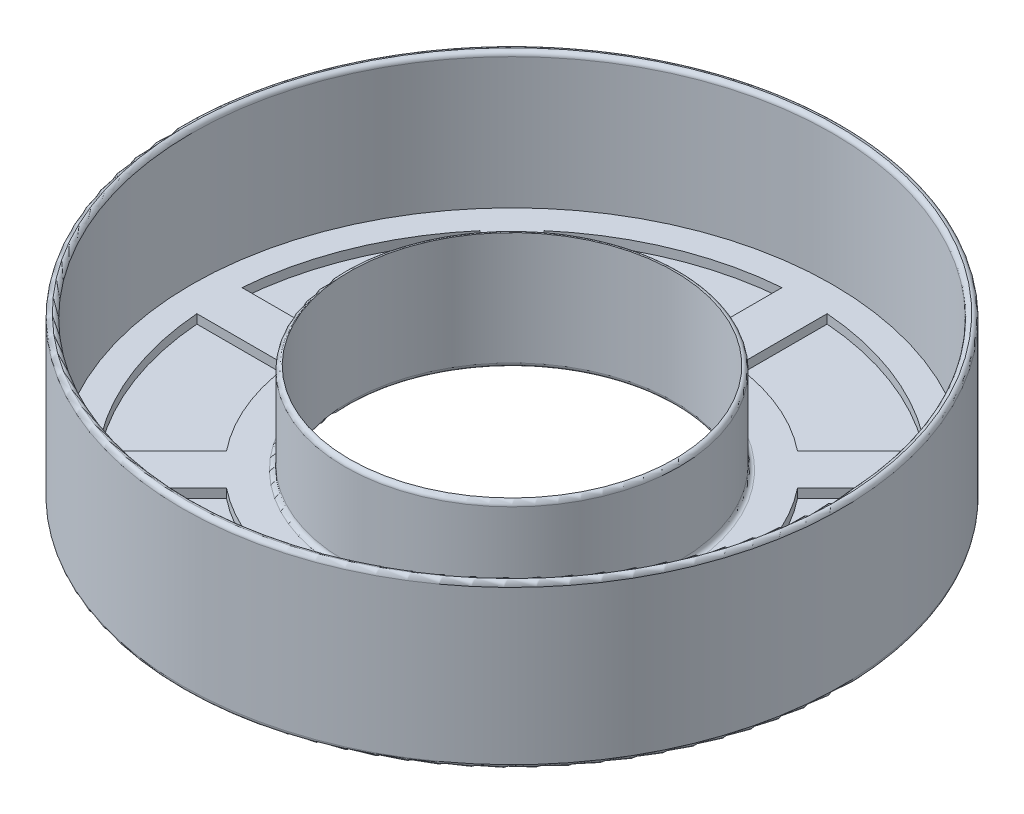
from build123d import *

# Parameters (mm, degrees)
SKETCH2_R           = 36.5
SKETCH2_R_2         = 18
BOSS_EXTRUDE1_DEPTH = 3
SKETCH3_R           = 36.5
SKETCH3_R_2         = 35.5
BOSS_EXTRUDE2_DEPTH = 15
SKETCH4_R           = 18.5
SKETCH4_R_2         = 18
BOSS_EXTRUDE3_DEPTH = 10
FILLET1_R           = 0.5
CUT_EXTRUDE1_DEPTH  = 1


with BuildPart() as part:
    # Sketch2 → Boss-Extrude1 (new body)
    with BuildSketch(Plane(origin=(0, 0, 0), x_dir=(1, 0, 0), z_dir=(0, 1, 0))):
        with Locations(Location((0, 0, 0), (0, 0, 270))):
            Circle(SKETCH2_R)
        with Locations(Location((0, 0, 0), (0, 0, 270))):
            Circle(SKETCH2_R_2, mode=Mode.SUBTRACT)
    extrude(amount=BOSS_EXTRUDE1_DEPTH)

    # Sketch3 → Boss-Extrude2 (add)
    with BuildSketch(Plane(origin=(0, 3, 0), x_dir=(1, 0, 0), z_dir=(0, 1, 0))):
        with Locations(Location((0, 0, 0), (0, 0, 270))):
            Circle(SKETCH3_R)
        with Locations(Location((0, 0, 0), (0, 0, 270))):
            Circle(SKETCH3_R_2, mode=Mode.SUBTRACT)
    extrude(amount=BOSS_EXTRUDE2_DEPTH)

    # Sketch4 → Boss-Extrude3 (add)
    with BuildSketch(Plane(origin=(0, 3, 0), x_dir=(1, 0, 0), z_dir=(0, 1, 0))):
        with Locations(Location((0, 0, 0), (0, 0, 270))):
            Circle(SKETCH4_R)
        with Locations(Location((0, 0, 0), (0, 0, 270))):
            Circle(SKETCH4_R_2, mode=Mode.SUBTRACT)
    extrude(amount=BOSS_EXTRUDE3_DEPTH)

    # Fillet1
    fillet1_edges = [part.edges().sort_by_distance(p)[0] for p in [
        (0, 18, -35.5),
        (0, 18, -36.5),
        (0, 3, -18.5),
        (0, 13, -18.5),
        (0, 0, -36.5),
        (0, 0, -18),
    ]]
    fillet(fillet1_edges, radius=FILLET1_R - 0.0001)  # a hair under: the kernel refuses the full size

    # Sketch5 → Cut-Extrude1 (cut)
    with BuildSketch(Plane(origin=(0, 3, 0), x_dir=(1, 0, 0), z_dir=(0, 1, 0))):
        with BuildLine():
            ThreePointArc((-2.5, 22.360679775), (-8.610377228, 20.787289482), (-14.043621348, 17.579155254))
            Line((-14.043621348, 17.579155254), (-21.145111522, 24.680645428))
            ThreePointArc((-21.145111522, 24.680645428), (-12.437211552, 30.026084807), (-2.5, 32.403703492))
            Line((-2.5, 32.403703492), (-2.5, 22.360679775))
        make_face()
        with BuildLine():
            Line((14.043621348, 17.579155254), (21.145111522, 24.680645428))
            ThreePointArc((21.145111522, 24.680645428), (12.437211552, 30.026084807), (2.5, 32.403703492))
            Line((2.5, 32.403703492), (2.5, 22.360679775))
            ThreePointArc((2.5, 22.360679775), (8.610377228, 20.787289482), (14.043621348, 17.579155254))
        make_face()
        with BuildLine():
            Line((22.360679775, 2.5), (32.403703492, 2.5))
            ThreePointArc((32.403703492, 2.5), (30.026084807, 12.437211552), (24.680645428, 21.145111522))
            Line((24.680645428, 21.145111522), (17.579155254, 14.043621348))
            ThreePointArc((17.579155254, 14.043621348), (20.787289482, 8.610377228), (22.360679775, 2.5))
        make_face()
        with BuildLine():
            Line((24.680645428, -21.145111522), (17.579155254, -14.043621348))
            ThreePointArc((17.579155254, -14.043621348), (20.787289482, -8.610377228), (22.360679775, -2.5))
            Line((22.360679775, -2.5), (32.403703492, -2.5))
            ThreePointArc((32.403703492, -2.5), (30.026084807, -12.437211552), (24.680645428, -21.145111522))
        make_face()
        with BuildLine():
            ThreePointArc((-17.579155254, 14.043621348), (-20.787289482, 8.610377228), (-22.360679775, 2.5))
            Line((-22.360679775, 2.5), (-32.403703492, 2.5))
            ThreePointArc((-32.403703492, 2.5), (-30.026084807, 12.437211552), (-24.680645428, 21.145111522))
            Line((-24.680645428, 21.145111522), (-17.579155254, 14.043621348))
        make_face()
        with BuildLine():
            ThreePointArc((-22.360679775, -2.5), (-20.787289482, -8.610377228), (-17.579155254, -14.043621348))
            Line((-17.579155254, -14.043621348), (-24.680645428, -21.145111522))
            ThreePointArc((-24.680645428, -21.145111522), (-30.026084807, -12.437211552), (-32.403703492, -2.5))
            Line((-32.403703492, -2.5), (-22.360679775, -2.5))
        make_face()
        with BuildLine():
            Line((-14.043621348, -17.579155254), (-21.145111522, -24.680645428))
            ThreePointArc((-21.145111522, -24.680645428), (-12.437211552, -30.026084807), (-2.5, -32.403703492))
            Line((-2.5, -32.403703492), (-2.5, -22.360679775))
            ThreePointArc((-2.5, -22.360679775), (-8.610377228, -20.787289482), (-14.043621348, -17.579155254))
        make_face()
        with BuildLine():
            Line((2.5, -22.360679775), (2.5, -32.403703492))
            ThreePointArc((2.5, -32.403703492), (12.437211552, -30.026084807), (21.145111522, -24.680645428))
            Line((21.145111522, -24.680645428), (14.043621348, -17.579155254))
            ThreePointArc((14.043621348, -17.579155254), (8.610377228, -20.787289482), (2.5, -22.360679775))
        make_face()
    extrude(amount=-CUT_EXTRUDE1_DEPTH, mode=Mode.SUBTRACT)


solid = part.part
